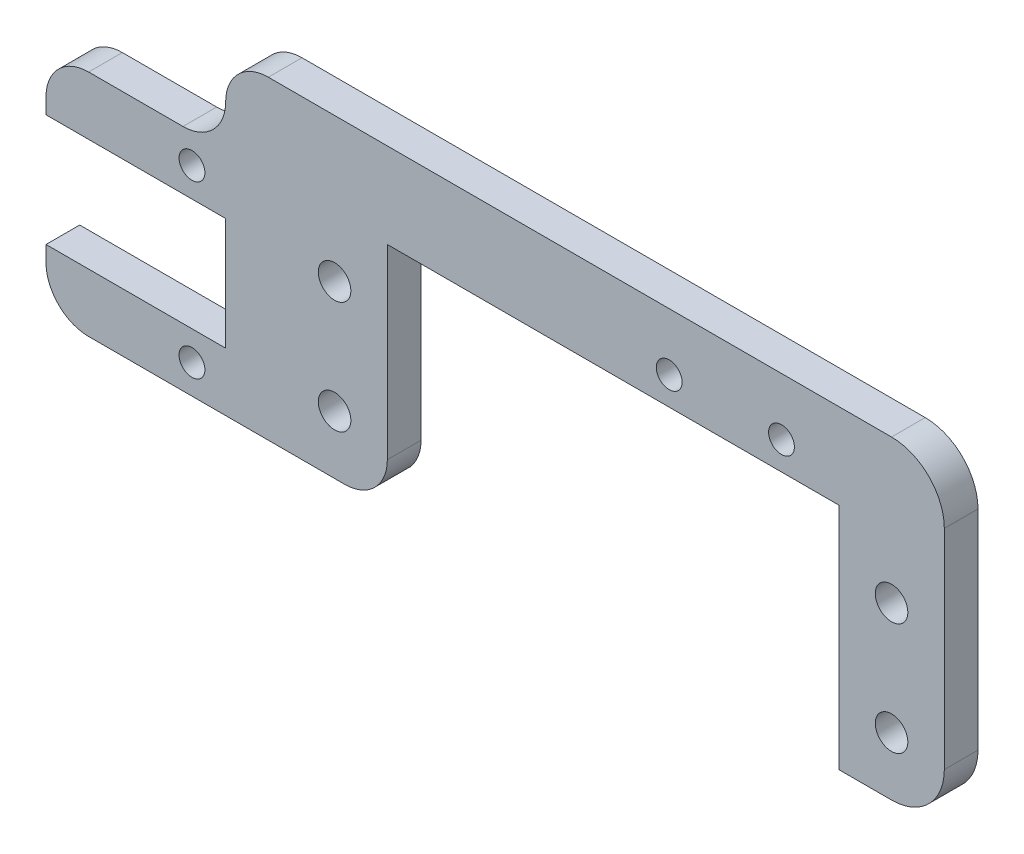
from build123d import *

# Parameters (mm, degrees)
BOSS_EXTRUDE7_DEPTH = 3
SKETCH12_R          = 1.15
CUT_EXTRUDE3_DEPTH  = 75.228296491
SKETCH11_R          = 1.45
CUT_EXTRUDE4_DEPTH  = 75.228296491
SKETCH13_R          = 1.15
CUT_EXTRUDE5_DEPTH  = 75.228296491
FILLET1_R           = 4.7
FILLET2_R           = 3.8


with BuildPart() as part:
    # Sketch10 → Boss-Extrude7 (new body)
    with BuildSketch(Plane.XY):
        Polygon((22.4, 10.2), (62.6, 10.2), (62.6, -10.2), (72, -10.2), (72, 17.8), (8, 17.8), (8, 10.2), (-8, 10.2), (-8, 5), (8, 5), (8, -5), (-8, -5), (-8, -10.2), (22.4, -10.2), align=None)
    extrude(amount=-BOSS_EXTRUDE7_DEPTH)

    # Sketch12 → Cut-Extrude3 (cut, through all)
    with BuildSketch(Plane(origin=(0, 0, 0), x_dir=(-1, 0, 0), z_dir=(0, 0, -1))):
        with Locations((-57.5, 12.7)):
            Circle(SKETCH12_R)
        with Locations((-47.5, 12.7)):
            Circle(SKETCH12_R)
    extrude(amount=CUT_EXTRUDE3_DEPTH, mode=Mode.SUBTRACT)

    # Sketch11 → Cut-Extrude4 (cut, through all)
    with BuildSketch(Plane(origin=(0, 0, 0), x_dir=(-1, 0, 0), z_dir=(0, 0, -1))):
        with Locations((-67.3, -5)):
            Circle(SKETCH11_R)
        with Locations((-17.7, -5)):
            Circle(SKETCH11_R)
        with Locations((-17.7, 5)):
            Circle(SKETCH11_R)
        with Locations((-67.3, 5)):
            Circle(SKETCH11_R)
    extrude(amount=CUT_EXTRUDE4_DEPTH, mode=Mode.SUBTRACT)

    # Sketch13 → Cut-Extrude5 (cut, through all)
    with BuildSketch(Plane.XY):
        with Locations((5, 7.6)):
            Circle(SKETCH13_R)
        with Locations((5, -7.6)):
            Circle(SKETCH13_R)
    extrude(amount=-CUT_EXTRUDE5_DEPTH, mode=Mode.SUBTRACT)

    # Fillet1
    fillet1_edges = [part.edges().sort_by_distance(p)[0] for p in [
        (72, 17.8, -1.5),
        (72, -10.2, -1.5),
    ]]
    fillet(fillet1_edges, radius=FILLET1_R)

    # Fillet2
    fillet2_edges = [part.edges().sort_by_distance(p)[0] for p in [
        (22.4, -10.2, -1.5),
        (-8, -10.2, -1.5),
        (8, 17.8, -1.5),
        (8, 10.2, -1.5),
        (-8, 10.2, -1.5),
    ]]
    fillet(fillet2_edges, radius=FILLET2_R - 0.0001)  # a hair under: the kernel refuses the full size


solid = part.part
